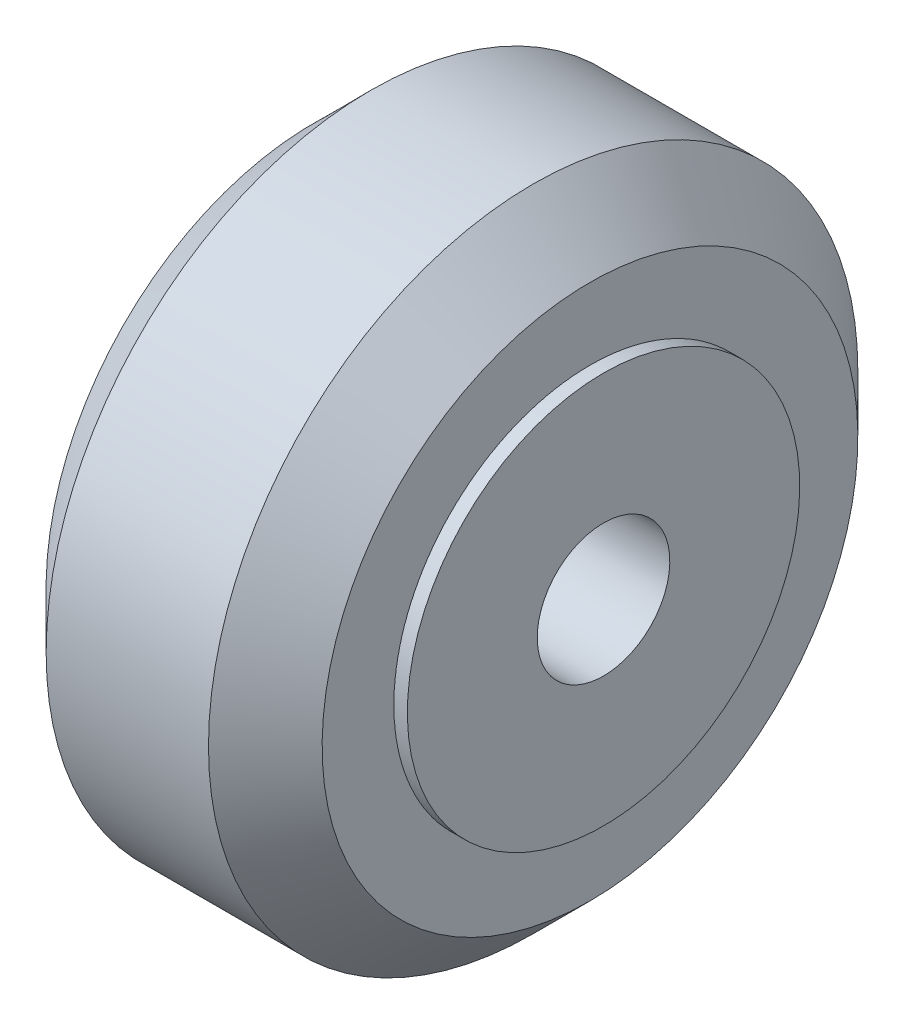
from build123d import *

# Parameters (mm, degrees)
SALIENTE_EXTRUIR1_DEPTH      = 0.5
SALIENTE_EXTRUIR1_DEPTH_BACK = 10.6
CROQUIS2_R                   = 7.25
CROQUIS2_R_2                 = 2.45
CORTAR_EXTRUIR1_DEPTH        = 14
CORTAR_EXTRUIR1_DEPTH_BACK   = 17.5
CROQUIS3_R                   = 7.25


with BuildPart() as part:
    # Croquis1 → Revolución1 (revolve)
    with BuildSketch(Plane.XY):
        Polygon((3, 12), (-3, 12), (-5.1, 9.9), (-5.1, 2.45), (-3, 2.45), (3, 2.45), (5.1, 2.45), (5.1, 9.9), align=None)
    revolve(axis=Axis((0, 0, 0), (1, 0, 0)))

    # Croquis3 → Cortar-Extruir1 (cut, two sides: drawn at the far end of the back side and taken through both)
    with BuildSketch(Plane(origin=(5.1, 0, 0), x_dir=(0, 0, -1), z_dir=(1, 0, 0)).offset(-CORTAR_EXTRUIR1_DEPTH_BACK)):
        Circle(CROQUIS3_R)
    extrude(amount=CORTAR_EXTRUIR1_DEPTH + CORTAR_EXTRUIR1_DEPTH_BACK, mode=Mode.SUBTRACT)


with BuildPart() as body_2:
    # Croquis2 → Saliente-Extruir1 (new, two sides: drawn at the far end of the back side and taken through both)
    with BuildSketch(Plane(origin=(5.1, 0, 0), x_dir=(0, 0, -1), z_dir=(1, 0, 0)).offset(-SALIENTE_EXTRUIR1_DEPTH_BACK)):
        Circle(CROQUIS2_R)
        Circle(CROQUIS2_R_2, mode=Mode.SUBTRACT)
    extrude(amount=SALIENTE_EXTRUIR1_DEPTH + SALIENTE_EXTRUIR1_DEPTH_BACK)


solid = Compound([part.part, body_2.part])
